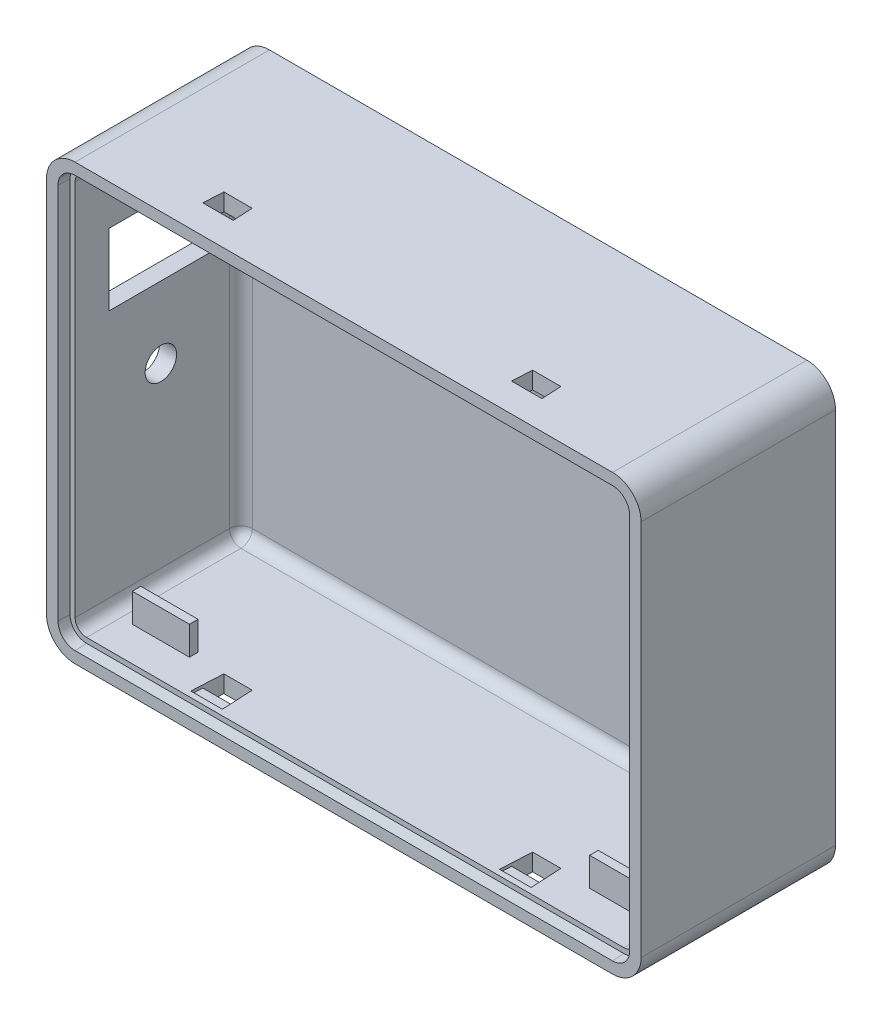
from build123d import *

# Parameters (mm, degrees)
SKETCH1_W                                = 104
SKETCH1_H                                = 76
BOSS_EXTRUDE1_DEPTH                      = 34
FILLET1_R                                = 5
SHELL1_T                                 = -3
FILLET2_R                                = 2
SKETCH2_W                                = 10
SKETCH2_H                                = 1.5
BOSS_EXTRUDE2_DEPTH                      = 5
MIRROR2_COPY_1_SKETCH_W                  = 10
MIRROR2_COPY_1_SKETCH_H                  = 1.5
MIRROR2_COPY_1_DEPTH                     = 5
LIP_GROOVE3_GROOVE_DEPTH                 = 2
LIP_GROOVE3_GROOVE_DRAFT                 = -3
SNAP_START                               = -38
SNAP_GROOVE1_DEPTH                       = 3
SNAP_START_2                             = -35.5
SNAP_GROOVE1_2_DEPTH                     = 0.5
MIRROR4_START                            = -38
MIRROR4_AT_THE_SECOND_PLANE_COPY_1_DEPTH = 3
MIRROR4_START_2                          = -35.5
MIRROR4_AT_THE_SECOND_PLANE_COPY_2_DEPTH = 0.5
MIRROR4_AT_THE_SECOND_PLANE_COPY_3_DEPTH = 0.5
SKETCH4_R                                = 2.75
SKETCH4_W                                = 18.1
SKETCH4_H                                = 12.5
CUT_EXTRUDE1_DEPTH                       = 3


# Read off the part's stored shape, not the designer's step: Lip&Groove3-Groove, Snap Groove1
with BuildPart() as part:
    # Sketch1 → Boss-Extrude1 (new body)
    with BuildSketch(Plane.XY):
        Rectangle(SKETCH1_W, SKETCH1_H)
    extrude(amount=BOSS_EXTRUDE1_DEPTH)

    # Fillet1
    fillet1_edges = [part.edges().sort_by_distance(p)[0] for p in [
        (-52, 38, 17),
        (52, 38, 17),
        (52, -38, 17),
        (-52, -38, 17),
    ]]
    fillet(fillet1_edges, radius=FILLET1_R)

    # Shell1
    shell1_openings = [part.faces().sort_by_distance(p)[0] for p in [
        (0, 0, 34),
    ]]
    offset(amount=SHELL1_T, openings=shell1_openings, kind=Kind.INTERSECTION)

    # Fillet2
    fillet2_edges = [part.edges().sort_by_distance(p)[0] for p in [
        (-49, 0, 3),
        (0, -35, 3),
        (49, 0, 3),
        (0, 35, 3),
        (-48.414213562, 34.414213562, 3),
        (48.414213562, 34.414213562, 3),
        (48.414213562, -34.414213562, 3),
        (-48.414213562, -34.414213562, 3),
    ]]
    fillet(fillet2_edges, radius=FILLET2_R)

    # Sketch2 → Boss-Extrude2 (add)
    with BuildSketch(Plane.XZ.offset(-35)):
        with Locations((-40, 25.25)):
            Rectangle(SKETCH2_W, SKETCH2_H)
    boss_extrude2 = extrude(amount=BOSS_EXTRUDE2_DEPTH)

    # Mirror1: Boss-Extrude2 across plane
    add(boss_extrude2.mirror(Plane(origin=(0, 0, 0), x_dir=(0, 0, 1), z_dir=(1, 0, 0))))

    # Mirror2: Boss-Extrude2 across plane
    add(boss_extrude2.mirror(Plane.ZX))

    # Mirror2 copy 1 sketch → Mirror2 copy 1 (add)
    with BuildSketch(Plane(origin=(0, -35, 0), x_dir=(-1, 0, 0), z_dir=(0, 1, 0))):
        with Locations((-40, 25.25)):
            Rectangle(MIRROR2_COPY_1_SKETCH_W, MIRROR2_COPY_1_SKETCH_H)
    extrude(amount=MIRROR2_COPY_1_DEPTH)


with BuildPart() as lip_groove3_groove_tool:
    # Lip&Groove3-Groove outline → Lip&Groove3-Groove (with draft: the straight prism first)
    with BuildSketch(Plane.XY.offset(32)):
        with BuildLine():
            ThreePointArc((-47, 35.895184441), (-49.047204551, 35.047204551), (-49.895184441, 33))
            Line((-49.895184441, 33), (-49.895184441, -33))
            ThreePointArc((-49.895184441, -33), (-49.047204551, -35.047204551), (-47, -35.895184441))
            Line((-47, -35.895184441), (47, -35.895184441))
            ThreePointArc((47, -35.895184441), (49.047204551, -35.047204551), (49.895184441, -33))
            Line((49.895184441, -33), (49.895184441, 33))
            ThreePointArc((49.895184441, 33), (49.047204551, 35.047204551), (47, 35.895184441))
            Line((47, 35.895184441), (-47, 35.895184441))
        make_face()
        with BuildLine():
            Line((-47, 35), (47, 35))
            ThreePointArc((47, 35), (48.414213562, 34.414213562), (49, 33))
            Line((49, 33), (49, -33))
            ThreePointArc((49, -33), (48.414213562, -34.414213562), (47, -35))
            Line((47, -35), (-47, -35))
            ThreePointArc((-47, -35), (-48.414213562, -34.414213562), (-49, -33))
            Line((-49, -33), (-49, 33))
            ThreePointArc((-49, 33), (-48.414213562, 34.414213562), (-47, 35))
        make_face(mode=Mode.SUBTRACT)
    extrude(amount=LIP_GROOVE3_GROOVE_DEPTH)
    # Lip&Groove3-Groove: the draft: its side faces are tilted about the plane it starts from
    lip_groove3_groove_sides = [lip_groove3_groove_tool.faces().sort_by_distance(p)[0] for p in [
        (-49.047204551, 35.047204551, 33),
        (-49.895184441, 0, 33),
        (-49.047204551, -35.047204551, 33),
        (0, -35.895184441, 33),
        (49.047204551, -35.047204551, 33),
        (49.895184441, 0, 33),
        (49.047204551, 35.047204551, 33),
        (0, 35.895184441, 33),
        (0, 35, 33),
        (48.414213562, 34.414213562, 33),
        (49, 0, 33),
        (48.414213562, -34.414213562, 33),
        (0, -35, 33),
        (-48.414213562, -34.414213562, 33),
        (-49, 0, 33),
        (-48.414213562, 34.414213562, 33),
    ]]
    draft(lip_groove3_groove_sides, Plane.XY.offset(32), LIP_GROOVE3_GROOVE_DRAFT)


with BuildPart() as part_1:
    add(part.part)

    # Lip&Groove3-Groove: cut by lip_groove3_groove_tool
    add(lip_groove3_groove_tool.part, mode=Mode.SUBTRACT)

    # Snap Groove1 outline → Snap Groove1 (cut)
    with BuildSketch(Plane(origin=(0, 0, 0), x_dir=(1, 0, 0), z_dir=(0, 1, 0)).offset(SNAP_START)):
        Polygon((-29.47379611, -25.5), (-29.657223337, -29), (-24.342776662, -29), (-24.52620389, -25.5), align=None)
    snap_groove1 = extrude(amount=SNAP_GROOVE1_DEPTH, mode=Mode.SUBTRACT)

    # Snap Groove1 2 outline → Snap Groove1 2 (cut)
    with BuildSketch(Plane(origin=(0, 0, 0), x_dir=(1, 0, 0), z_dir=(0, 1, 0)).offset(SNAP_START_2)):
        Polygon((-24.342776662, -29), (-29.657223338, -29), (-29.762038896, -31), (-24.237961104, -31), align=None)
    snap_groove1_2 = extrude(amount=SNAP_GROOVE1_2_DEPTH, mode=Mode.SUBTRACT)

    # Mirror4: Snap Groove1, Snap Groove1 2 across plane
    add(snap_groove1.mirror(Plane(origin=(0, 0, 0), x_dir=(0, 0, 1), z_dir=(1, 0, 0))), mode=Mode.SUBTRACT)
    add(snap_groove1_2.mirror(Plane(origin=(0, 0, 0), x_dir=(0, 0, 1), z_dir=(1, 0, 0))), mode=Mode.SUBTRACT)

    # Mirror4 at the second plane: Snap Groove1, Snap Groove1 2 across plane
    add(snap_groove1.mirror(Plane.ZX), mode=Mode.SUBTRACT)
    add(snap_groove1_2.mirror(Plane.ZX), mode=Mode.SUBTRACT)

    # Mirror4 at the second plane copy 1 sketc → Mirror4 at the second plane copy 1 (cut)
    with BuildSketch(Plane(origin=(0, 0, 0), x_dir=(-1, 0, 0), z_dir=(0, -1, 0)).offset(MIRROR4_START)):
        Polygon((-29.47379611, -25.5), (-29.657223337, -29), (-24.342776662, -29), (-24.52620389, -25.5), align=None)
    extrude(amount=MIRROR4_AT_THE_SECOND_PLANE_COPY_1_DEPTH, mode=Mode.SUBTRACT)

    # Mirror4 at the second plane copy 2 sketc → Mirror4 at the second plane copy 2 (cut)
    with BuildSketch(Plane(origin=(0, 0, 0), x_dir=(-1, 0, 0), z_dir=(0, -1, 0)).offset(MIRROR4_START_2)):
        Polygon((-24.342776662, -29), (-29.657223338, -29), (-29.762038896, -31), (-24.237961104, -31), align=None)
    extrude(amount=MIRROR4_AT_THE_SECOND_PLANE_COPY_2_DEPTH, mode=Mode.SUBTRACT)

    # Mirror4 at the second plane copy 3 sketc → Mirror4 at the second plane copy 3 (cut)
    with BuildSketch(Plane.XZ.offset(MIRROR4_START_2)):
        Polygon((-24.342776662, 29), (-29.657223338, 29), (-29.762038896, 31), (-24.237961104, 31), align=None)
    extrude(amount=MIRROR4_AT_THE_SECOND_PLANE_COPY_3_DEPTH, mode=Mode.SUBTRACT)

    # Sketch4 → Cut-Extrude1 (cut)
    with BuildSketch(Plane.ZY.offset(52)):
        with Locations(Location((17, -2, 0), (0, 0, 270))):
            Circle(SKETCH4_R)
        with Locations((17.05, 16.75)):
            Rectangle(SKETCH4_W, SKETCH4_H)
    extrude(amount=-CUT_EXTRUDE1_DEPTH, mode=Mode.SUBTRACT)


solid = part_1.part
